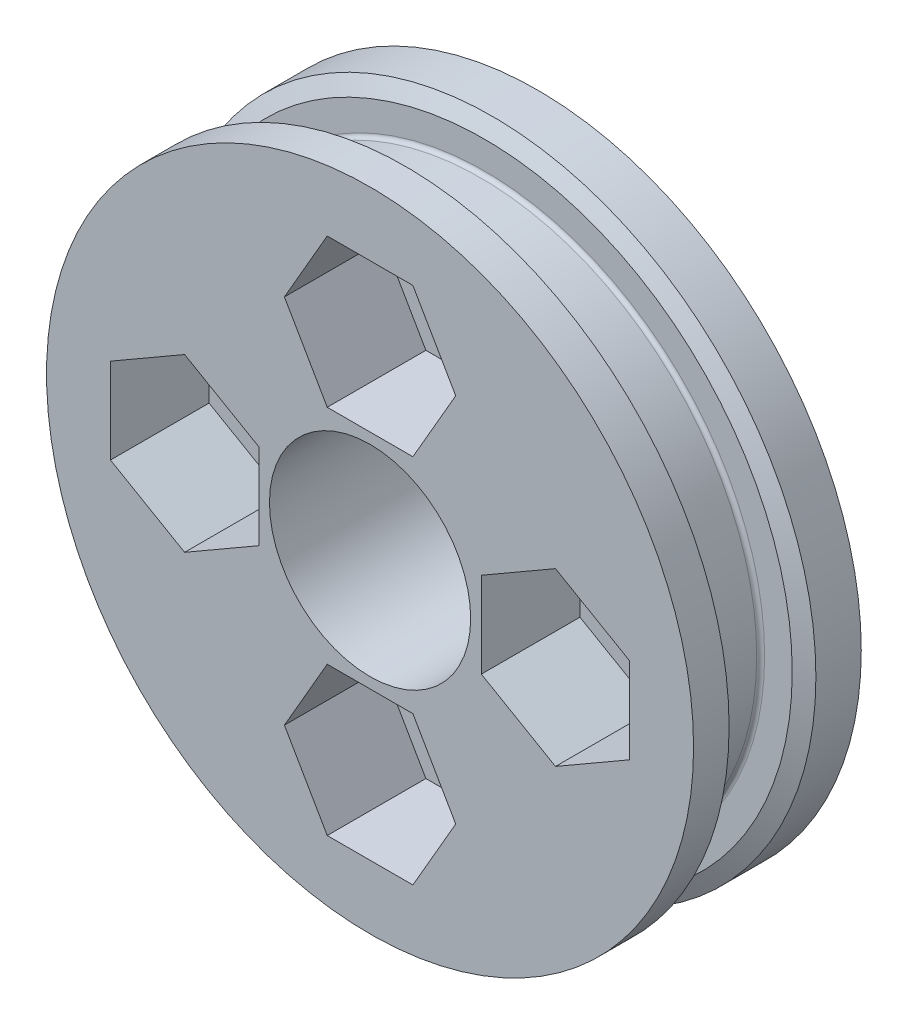
from build123d import *

# Parameters (mm, degrees)
SKETCH3_W               = 16.51
SKETCH3_H               = 16.51
SKETCH3_R               = 6.477
BOSS_EXTRUDE1_DEPTH     = 3.175
CUT_EXTRUDE1_DEPTH      = 32.371056613
CUT_EXTRUDE1_DEPTH_BACK = 32.371056613
SKETCH4_R               = 2.54
FILLET1_R               = 0.254
CUT_EXTRUDE2_DEPTH      = 6.35
CIRPATTERN1_COUNT       = 4


with BuildPart() as part:
    # Sketch2 → Revolve1 (revolve)
    with BuildSketch(Plane(origin=(0, 0, 0), x_dir=(0, 0, -1), z_dir=(1, 0, 0))):
        Polygon((0, 6.477), (0, 20.828), (2.286, 20.828), (2.794, 19.812), (2.794, 17.78), (7.366, 17.78), (7.366, 19.812), (7.874, 20.828), (10.795, 20.828), (10.795, 6.477), align=None)
    revolve(axis=Axis((0, 0, 0), (0, 0, -1)))

    # Sketch3 → Boss-Extrude1 (add)
    with BuildSketch(Plane(origin=(0, 0, -10.795), x_dir=(-1, 0, 0), z_dir=(0, 0, -1))):
        Rectangle(SKETCH3_W, SKETCH3_H)
        Circle(SKETCH3_R, mode=Mode.SUBTRACT)
    extrude(amount=BOSS_EXTRUDE1_DEPTH)

    # Sketch4 → Cut-Extrude1 (cut, two sides: drawn at the far end of the back side and taken through both)
    with BuildSketch(Plane(origin=(0, 0, -10.795), x_dir=(-1, 0, 0), z_dir=(0, 0, -1)).offset(-CUT_EXTRUDE1_DEPTH_BACK)):
        with Locations((0, 11.938)):
            Circle(SKETCH4_R)
        with Locations((11.938, 0)):
            Circle(SKETCH4_R)
        with Locations((0, -11.938)):
            Circle(SKETCH4_R)
        with Locations((-11.938, 0)):
            Circle(SKETCH4_R)
    extrude(amount=CUT_EXTRUDE1_DEPTH + CUT_EXTRUDE1_DEPTH_BACK, mode=Mode.SUBTRACT)

    # Fillet1
    fillet1_edges = [part.edges().sort_by_distance(p)[0] for p in [
        (0, -17.78, -7.366),
        (0, -17.78, -2.794),
    ]]
    fillet(fillet1_edges, radius=FILLET1_R)

    # Sketch5 → Cut-Extrude2 (cut)
    with BuildSketch(Plane.XY):
        Polygon((2.756963005, 7.1628), (5.513926011, 11.938), (2.756963005, 16.7132), (-2.756963005, 16.7132), (-5.513926011, 11.938), (-2.756963005, 7.1628), align=None)
    cut_extrude2 = extrude(amount=-CUT_EXTRUDE2_DEPTH, mode=Mode.SUBTRACT)

    # CirPattern1: Cut-Extrude2 ×4 about axis
    cirpattern1_axis = Axis((0, 0, 0), (0, 0, 1))
    for i in range(1, CIRPATTERN1_COUNT):
        add(cut_extrude2.rotate(cirpattern1_axis, i * 360 / CIRPATTERN1_COUNT), mode=Mode.SUBTRACT)


solid = part.part
